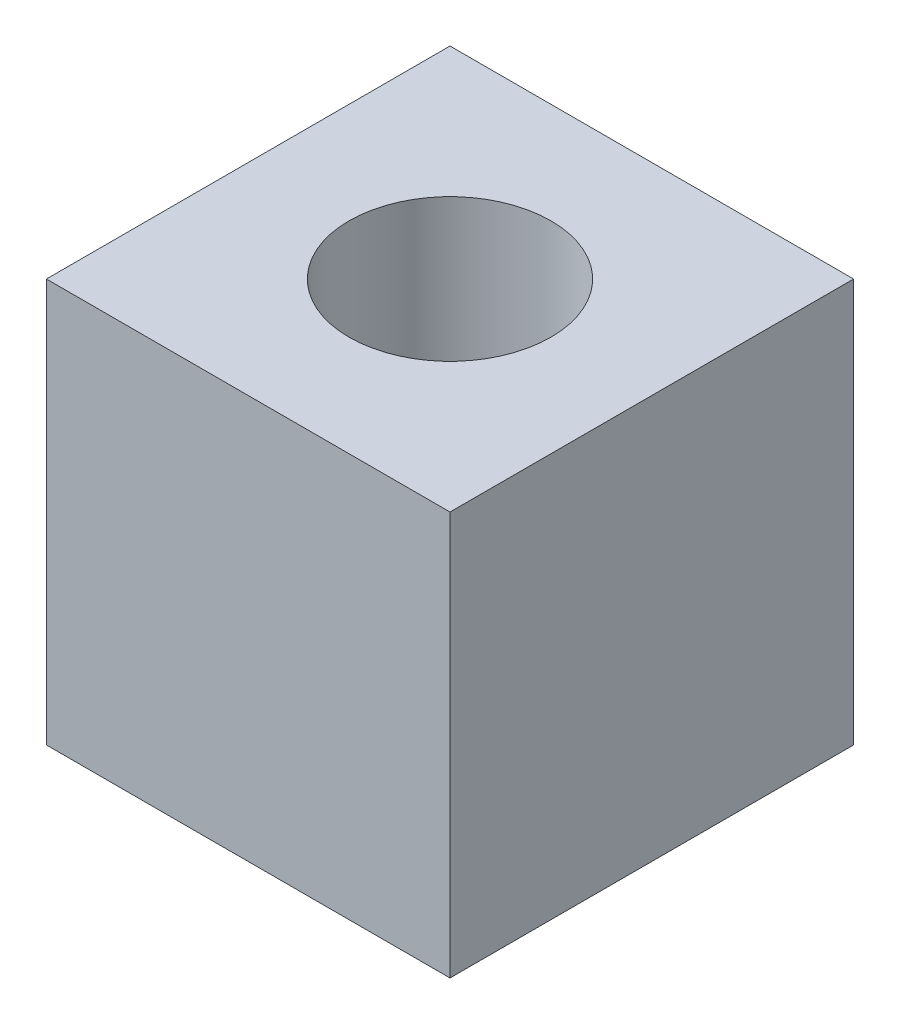
from build123d import *

# Parameters (mm, degrees)
SKETCH1_W           = 30
SKETCH1_H           = 30
BOSS_EXTRUDE1_DEPTH = 30
SKETCH2_R           = 7.5
CUT_EXTRUDE1_DEPTH  = 30


with BuildPart() as part:
    # Sketch1 → Boss-Extrude1 (new body)
    with BuildSketch(Plane(origin=(0, 0, 0), x_dir=(1, 0, 0), z_dir=(0, 1, 0))):
        with Locations((15, 15)):
            Rectangle(SKETCH1_W, SKETCH1_H)
    extrude(amount=BOSS_EXTRUDE1_DEPTH)

    # Sketch2 → Cut-Extrude1 (cut)
    with BuildSketch(Plane.XZ):
        with Locations((15, -15)):
            Circle(SKETCH2_R)
    extrude(amount=-CUT_EXTRUDE1_DEPTH, mode=Mode.SUBTRACT)


solid = part.part
